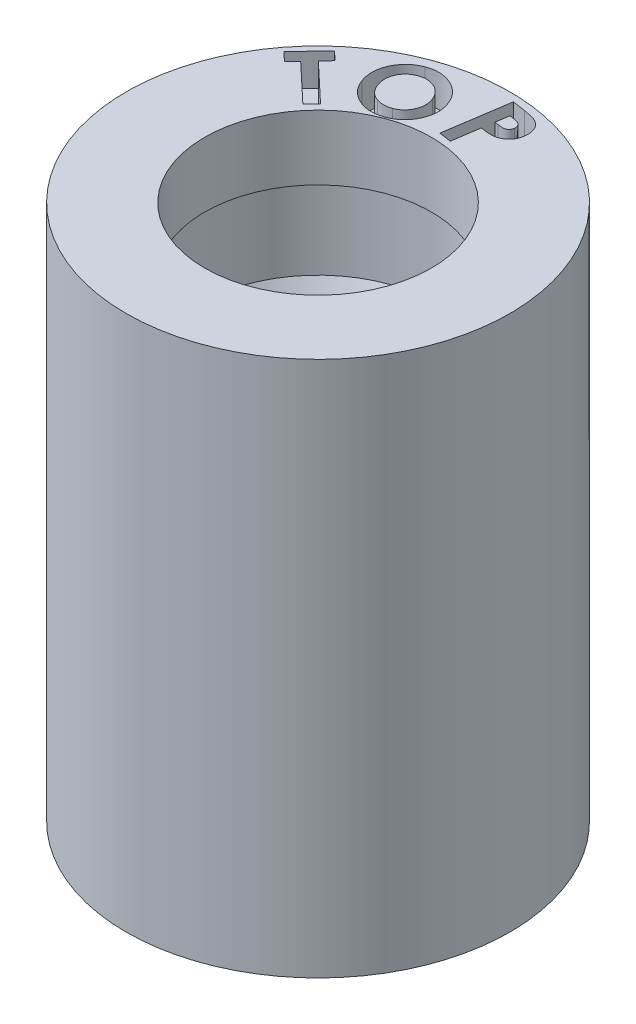
from build123d import *

# Parameters (mm, degrees)
CUT_EXTRUDE1_DEPTH = 1


with BuildPart() as part:
    # Sketch1 → Revolve1 (revolve)
    with BuildSketch(Plane.XY):
        Polygon((-5.925612063, 16.539460001), (-5.925612063, 0), (-2.5, 0), (-2.5, 1), (-3.527442252, 1), (-3.1, 2.174387937), (-3.1, 3.174387937), (-3.790860823, 4.604502573), (-3.2, 6.227879342), (-3.2, 7.227879342), (-3.868649263, 8.612014998), (-3.3, 10.174366009), (-3.3, 11.174366009), (-3.693734947, 11.989416004), (-3.693734947, 14.539460001), (-3.5, 14.539460001), (-3.5, 16.539460001), (-4.925612063, 16.539460001), align=None)
    revolve(axis=Axis((0, 31.746947892, 0), (0, -1, 0)))

    # Sketch2 → Cut-Extrude1 (cut)
    # profile 1 of 3: a face of its own
    with BuildSketch(Plane(origin=(0, 16.539460001, 0), x_dir=(1, 0, 0), z_dir=(0, 1, 0))):
        Polygon((-4.56436006, 3.510865228), (-3.80634724, 4.314951767), (-3.53311006, 4.057339587), (-3.78311006, 3.792115228), (-2.601219035, 2.677932536), (-2.866042752, 2.397083177), (-4.047933778, 3.511265869), (-4.291122881, 3.253253049), align=None)
    # profile 2 of 3: a face of its own
    with BuildSketch(Plane(origin=(0, 16.539460001, 0), x_dir=(1, 0, 0), z_dir=(0, 1, 0))):
        with BuildLine():
            add(Edge.make_bspline(
                [(-1.984008183, 5.280361602), (-1.951361471, 5.291864674), (-1.88694019, 5.314563519), (-1.787725021, 5.336370562), (-1.68867447, 5.348141474), (-1.589745002, 5.349694056), (-1.490857629, 5.341460898), (-1.392298103, 5.321755045), (-1.293748326, 5.292309021), (-1.196403871, 5.253275434), (-1.102663259, 5.205794342), (-1.015015452, 5.150302329), (-0.935150045, 5.087039683), (-0.861966979, 5.017138314), (-0.796876373, 4.939342491), (-0.73936393, 4.854147851), (-0.688944448, 4.76185377), (-0.661954334, 4.696238913), (-0.648271004, 4.662973781)],
                knots=[0, 0, 0, 0, 1.014620015, 2.002134859, 2.972530124, 3.936379391, 4.899703057, 5.877754481, 6.8792585, 7.912999375, 8.950201094, 9.957656246, 10.950665226, 11.934255845, 12.921397626, 13.919955046, 14.945467956, 16, 16, 16, 16], degree=3))
            add(Edge.make_bspline(
                [(-0.648271004, 4.662973781), (-0.63638026, 4.629392518), (-0.61295524, 4.563236713), (-0.589851307, 4.46165008), (-0.577140328, 4.360875701), (-0.573405857, 4.260609673), (-0.581411296, 4.161006464), (-0.59900927, 4.061774462), (-0.627409696, 3.96337395), (-0.665193824, 3.866652344), (-0.711800808, 3.774099537), (-0.765344192, 3.687244444), (-0.827037032, 3.608656621), (-0.895274393, 3.53691719), (-0.970765267, 3.472755362), (-1.053447889, 3.415996435), (-1.143233673, 3.366624476), (-1.207147436, 3.340505611), (-1.239617158, 3.327236602)],
                knots=[0, 0, 0, 0, 1.050443095, 2.069395309, 3.066451062, 4.044188339, 5.024281049, 6.009012539, 7.013051648, 8.041151473, 9.068526114, 10.066795816, 11.046571626, 12.010893031, 12.98366294, 13.964080367, 14.965704093, 16, 16, 16, 16], degree=3))
            add(Edge.make_bspline(
                [(-1.239617158, 3.327236602), (-1.274127433, 3.315054091), (-1.341989406, 3.291098061), (-1.445869846, 3.267661601), (-1.548514012, 3.254707417), (-1.650189905, 3.251930751), (-1.75089728, 3.261090365), (-1.850633006, 3.280394266), (-1.94954384, 3.310198365), (-2.045954485, 3.350999293), (-2.138143697, 3.40040609), (-2.22443778, 3.456402546), (-2.302868686, 3.519734512), (-2.374265293, 3.589345467), (-2.438323962, 3.665754961), (-2.494446917, 3.749315409), (-2.543893935, 3.839140593), (-2.569840129, 3.903068192), (-2.582966517, 3.935409679)],
                knots=[0, 0, 0, 0, 1.068399082, 2.100929906, 3.103575799, 4.086993591, 5.066099282, 6.051588829, 7.050066646, 8.078224887, 9.104508757, 10.102185959, 11.078879156, 12.044476055, 13.01104188, 13.985980333, 14.981091238, 16, 16, 16, 16], degree=3))
            add(Edge.make_bspline(
                [(-2.582966517, 3.935409679), (-2.591031999, 3.957608631), (-2.607000287, 4.001558795), (-2.625194192, 4.068869717), (-2.639487416, 4.136112234), (-2.648403317, 4.203638954), (-2.653985128, 4.271173172), (-2.654136841, 4.339047901), (-2.650302733, 4.407189998), (-2.641385851, 4.475167924), (-2.628161649, 4.542316332), (-2.611012019, 4.608054044), (-2.589636953, 4.671990291), (-2.564429793, 4.734318929), (-2.534734181, 4.794775853), (-2.500865551, 4.853430446), (-2.463311476, 4.910534936), (-2.421107468, 4.965051951), (-2.376303157, 5.017463289), (-2.327995092, 5.066095425), (-2.276893667, 5.110880435), (-2.22391969, 5.152796947), (-2.16764059, 5.190081477), (-2.109138956, 5.224223048), (-2.047940788, 5.254887272), (-2.005373568, 5.271848436), (-1.984008183, 5.280361602)],
                knots=[0, 0, 0, 0, 1.038304274, 2.055666484, 3.063558632, 4.059469263, 5.049125639, 6.041722948, 7.04190207, 8.048681291, 9.054243446, 10.05001552, 11.034377102, 12.017055174, 13.004687854, 13.993978178, 14.9941573, 16.007936071, 17.024025995, 18.02491189, 19.019436086, 20.011042457, 20.993299201, 21.985531542, 22.98889582, 24, 24, 24, 24], degree=3))
        make_face()
        with BuildLine():
            add(Edge.make_bspline(
                [(-1.856604337, 4.93220455), (-1.877488693, 4.92365394), (-1.91851888, 4.906855091), (-1.976141706, 4.875154856), (-2.029352302, 4.839330962), (-2.07716166, 4.797778435), (-2.121273982, 4.752720461), (-2.159788123, 4.701995242), (-2.193935, 4.647031656), (-2.222951228, 4.587951901), (-2.246566945, 4.526332772), (-2.263599351, 4.462972911), (-2.273536668, 4.398614762), (-2.27710429, 4.333408334), (-2.274490192, 4.267185167), (-2.264020731, 4.200196791), (-2.247720257, 4.132036594), (-2.232009133, 4.087262923), (-2.223992158, 4.064416089)],
                knots=[0, 0, 0, 0, 1.027375829, 2.018421, 2.990439743, 3.944023084, 4.899254799, 5.858180169, 6.839107485, 7.843140547, 8.852193577, 9.840995123, 10.826271385, 11.813424366, 12.81213429, 13.839510119, 14.897558497, 16, 16, 16, 16], degree=3))
            add(Edge.make_bspline(
                [(-2.223992158, 4.064416089), (-2.213798406, 4.039614197), (-2.193848628, 3.99107542), (-2.156249795, 3.9236025), (-2.113828887, 3.862281189), (-2.06483441, 3.80861926), (-2.011373958, 3.760637802), (-1.951978549, 3.720171095), (-1.887377574, 3.685917894), (-1.841209626, 3.669112319), (-1.817742158, 3.660569935)],
                knots=[0, 0, 0, 0, 1.083525323, 2.1205235, 3.11684475, 4.091862613, 5.05205136, 6.015227223, 6.991127069, 8, 8, 8, 8], degree=3))
            add(Edge.make_bspline(
                [(-1.817742158, 3.660569935), (-1.799002821, 3.654754787), (-1.762043231, 3.643285572), (-1.70554032, 3.632132288), (-1.649226843, 3.626132067), (-1.592931479, 3.624909068), (-1.536766699, 3.628526479), (-1.480722939, 3.636985935), (-1.424739365, 3.650502694), (-1.388282452, 3.663569843), (-1.369825491, 3.67018532)],
                knots=[0, 0, 0, 0, 1.029425888, 2.030336445, 3.017427379, 3.999126242, 4.982625746, 5.96814704, 6.971338277, 8, 8, 8, 8], degree=3))
            add(Edge.make_bspline(
                [(-1.369825491, 3.67018532), (-1.34949883, 3.678648278), (-1.309356026, 3.695361643), (-1.252607106, 3.72624702), (-1.200635206, 3.762435253), (-1.1536402, 3.803801847), (-1.110222276, 3.849045135), (-1.072357905, 3.899958064), (-1.038326537, 3.955219174), (-1.009568703, 4.014754411), (-0.985903475, 4.076913057), (-0.968659856, 4.140392331), (-0.957596172, 4.204373501), (-0.953708077, 4.26897552), (-0.956140066, 4.334052485), (-0.964994469, 4.399684223), (-0.98069353, 4.465819319), (-0.995897927, 4.509116919), (-1.003639594, 4.531162884)],
                knots=[0, 0, 0, 0, 1.013702308, 2.001944841, 2.969505415, 3.924311064, 4.881590383, 5.852274522, 6.840804181, 7.866971879, 8.892918308, 9.900179829, 10.892243886, 11.878378268, 12.875578152, 13.887337569, 14.924289568, 16, 16, 16, 16], degree=3))
            add(Edge.make_bspline(
                [(-1.003639594, 4.531162884), (-1.012468698, 4.552705636), (-1.029822569, 4.595048566), (-1.062108693, 4.654687243), (-1.099238225, 4.70938077), (-1.140491725, 4.759881587), (-1.18698285, 4.805198641), (-1.237600405, 4.8464288), (-1.293177353, 4.882458178), (-1.352515379, 4.913455711), (-1.414191915, 4.938948321), (-1.476774937, 4.958423701), (-1.539771322, 4.970857515), (-1.602851173, 4.977036053), (-1.666265934, 4.976195963), (-1.729885687, 4.968423593), (-1.793815921, 4.954098386), (-1.835495575, 4.939565013), (-1.856604337, 4.93220455)],
                knots=[0, 0, 0, 0, 1.064468554, 2.092245113, 3.095323204, 4.084803289, 5.069746878, 6.060094084, 7.066589321, 8.094020857, 9.118469475, 10.115576809, 11.087225592, 12.050716488, 13.009917633, 13.982104002, 14.978031626, 16, 16, 16, 16], degree=3))
        make_face(mode=Mode.SUBTRACT)
    # profile 3 of 3: a face of its own
    with BuildSketch(Plane(origin=(0, 16.539460001, 0), x_dir=(1, 0, 0), z_dir=(0, 1, 0))):
        with BuildLine():
            Line((0.319736773, 5.710692831), (0.717973953, 5.650196036))
            add(Edge.make_bspline(
                [(0.717973953, 5.650196036), (0.743902764, 5.646045699), (0.79385866, 5.638049427), (0.865780479, 5.62449996), (0.931643136, 5.60974626), (0.991715408, 5.594210641), (1.045898892, 5.577459816), (1.094240077, 5.559654843), (1.136670613, 5.540774211), (1.173848076, 5.520942792), (1.206955458, 5.499340015), (1.236881443, 5.475614656), (1.264775614, 5.450221564), (1.290589117, 5.422843815), (1.31409698, 5.393403719), (1.335182561, 5.361714757), (1.353769797, 5.328091897), (1.370838485, 5.292955797), (1.38468134, 5.255853927), (1.396514214, 5.217547543), (1.404720683, 5.177810596), (1.410460986, 5.136863936), (1.413156153, 5.09468289), (1.413115497, 5.051197309), (1.410363143, 5.006494117), (1.406329806, 4.976431285), (1.40427203, 4.961093472)],
                knots=[0, 0, 0, 0, 1.688229069, 3.252636493, 4.704540505, 6.02698088, 7.240917417, 8.349367494, 9.337115164, 10.224530104, 11.055662565, 11.875002781, 12.6772488, 13.479035212, 14.291644414, 15.096550986, 15.923013501, 16.760243991, 17.605405922, 18.466468419, 19.335414512, 20.210911126, 21.123029556, 22.050337979, 23.005298238, 24, 24, 24, 24], degree=3))
            add(Edge.make_bspline(
                [(1.40427203, 4.961093472), (1.401452611, 4.944348909), (1.395905318, 4.911403473), (1.383409886, 4.863710013), (1.367785295, 4.818727833), (1.349196456, 4.776456135), (1.328174232, 4.736451732), (1.303107475, 4.699666501), (1.275416801, 4.66544148), (1.244866226, 4.634018364), (1.211574799, 4.605867226), (1.176559052, 4.579861392), (1.139377902, 4.557158291), (1.10011758, 4.537347969), (1.058888378, 4.520478872), (1.015399143, 4.506998629), (0.970042726, 4.496009093), (0.93890313, 4.491185373), (0.923102158, 4.488737702)],
                knots=[0, 0, 0, 0, 1.117210854, 2.198146215, 3.240619598, 4.248268683, 5.23534936, 6.210538489, 7.172886701, 8.13016332, 9.090260798, 10.039635115, 10.998444087, 11.953700707, 12.931461489, 13.926727378, 14.947972086, 16, 16, 16, 16], degree=3))
            add(Edge.make_bspline(
                [(0.923102158, 4.488737702), (0.912828624, 4.487648862), (0.890460584, 4.485278186), (0.853916812, 4.484985168), (0.811954758, 4.485628073), (0.764674185, 4.488737979), (0.71202169, 4.493025514), (0.653958459, 4.49970374), (0.590338811, 4.507515769), (0.546217946, 4.514138258), (0.523262414, 4.517583856)],
                knots=[0, 0, 0, 0, 0.616710196, 1.34273161, 2.180398292, 3.12326001, 4.17183664, 5.335424521, 6.613654912, 8, 8, 8, 8], degree=3))
            Line((0.523262414, 4.517583856), (0.397060491, 3.6830486))
            Line((0.397060491, 3.6830486), (0.02165985, 3.739939625))
            Line((0.02165985, 3.739939625), (0.319736773, 5.710692831))
        make_face()
        with BuildLine():
            Line((0.578550876, 4.883369113), (0.697541261, 4.865340267))
            add(Edge.make_bspline(
                [(0.697541261, 4.865340267), (0.719283364, 4.862320542), (0.759208035, 4.856775471), (0.814178481, 4.852168958), (0.858797826, 4.851278874), (0.894596253, 4.854446528), (0.924004036, 4.862575762), (0.949580582, 4.874229986), (0.973042156, 4.889233252), (0.993492173, 4.908318224), (1.011224982, 4.930599401), (1.024855738, 4.956520109), (1.035495896, 4.985047193), (1.039324821, 5.005484965), (1.041291261, 5.015981292)],
                knots=[0, 0, 0, 0, 1.833449879, 3.366734321, 4.605095567, 5.558652403, 6.35706345, 7.140923108, 7.899035707, 8.672747628, 9.467252148, 10.265896979, 11.109408165, 12, 12, 12, 12], degree=3))
            add(Edge.make_bspline(
                [(1.041291261, 5.015981292), (1.042461017, 5.02518096), (1.044744085, 5.043136378), (1.044159855, 5.069503184), (1.04112273, 5.094441696), (1.034614557, 5.117911802), (1.025058202, 5.13991631), (1.012300825, 5.160359449), (0.996701546, 5.17928194), (0.984290354, 5.190284042), (0.977989979, 5.195869113)],
                knots=[0, 0, 0, 0, 1.109819556, 2.16608632, 3.150579647, 4.113375299, 5.073640952, 6.015054913, 6.992369208, 8, 8, 8, 8], degree=3))
            add(Edge.make_bspline(
                [(0.977989979, 5.195869113), (0.972589347, 5.199851811), (0.96102598, 5.208379221), (0.940929924, 5.219577628), (0.916976272, 5.229099242), (0.89003484, 5.239716671), (0.858835497, 5.247851306), (0.824331679, 5.256518719), (0.786209983, 5.264039929), (0.759522579, 5.268213745), (0.745618184, 5.270388343)],
                knots=[0, 0, 0, 0, 0.653317591, 1.39882744, 2.232434306, 3.16275391, 4.217064049, 5.36873055, 6.62908322, 8, 8, 8, 8], degree=3))
            Line((0.745618184, 5.270388343), (0.639848953, 5.286413984))
            Line((0.639848953, 5.286413984), (0.578550876, 4.883369113))
        make_face(mode=Mode.SUBTRACT)
    extrude(amount=-CUT_EXTRUDE1_DEPTH, mode=Mode.SUBTRACT)


solid = part.part
